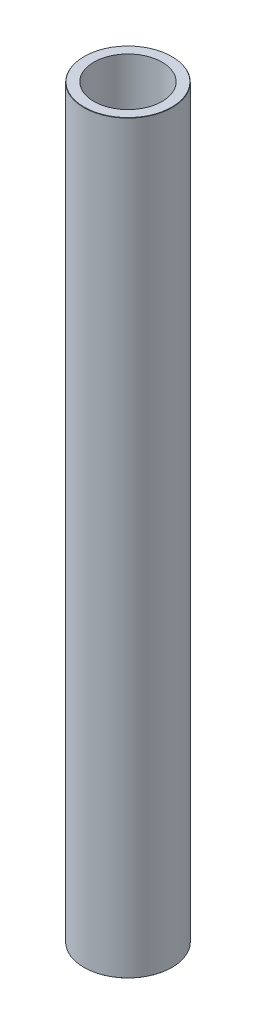
from build123d import *
from OCP.BRepFilletAPI import BRepFilletAPI_MakeChamfer

# Parameters (mm, degrees)
SKETCH1_R           = 32.5
BOSS_EXTRUDE1_DEPTH = 549.26050672
SKETCH2_R           = 25.127317011
CUT_EXTRUDE1_DEPTH  = 552.180192172
CHAMFER1_SIZE       = 0.217891045
CHAMFER1_SIZE2      = 0.183419026


with BuildPart() as part:
    # Sketch1 → Boss-Extrude1 (new body)
    with BuildSketch(Plane(origin=(0, 0, 0), x_dir=(1, 0, 0), z_dir=(0, 1, 0))):
        Circle(SKETCH1_R)
    extrude(amount=BOSS_EXTRUDE1_DEPTH)

    # Sketch2 → Cut-Extrude1 (cut, through all)
    with BuildSketch(Plane(origin=(0, 0, 0), x_dir=(1, 0, 0), z_dir=(0, 1, 0))):
        Circle(SKETCH2_R)
    extrude(amount=CUT_EXTRUDE1_DEPTH, mode=Mode.SUBTRACT)

    # Chamfer1: one chamfer whose edges measure the first distance from different faces: ONE call of the kernel's chamfer builder (chamfer() names one face for all edges)
    chamfer1_edges_1 = [part.edges().sort_by_distance(p)[0] for p in [
        (-32.5, 549.26050672, 0),
    ]]
    chamfer1_side_1 = [part.faces().sort_by_distance(p)[0] for p in [
        (-32.5, 274.63025336, 0),
    ]]
    chamfer1_edges_2 = [part.edges().sort_by_distance(p)[0] for p in [
        (-32.5, 0, 0),
    ]]
    chamfer1_side_2 = [part.faces().sort_by_distance(p)[0] for p in [
        (-31.580761184, 0, 0),
    ]]
    chamfer1 = BRepFilletAPI_MakeChamfer(part.part.solid().wrapped)
    for e in chamfer1_edges_1:
        chamfer1.Add(CHAMFER1_SIZE, CHAMFER1_SIZE2, e.wrapped, chamfer1_side_1[0].wrapped)  # the first distance lies on this face
    for e in chamfer1_edges_2:
        chamfer1.Add(CHAMFER1_SIZE, CHAMFER1_SIZE2, e.wrapped, chamfer1_side_2[0].wrapped)  # the first distance lies on this face
    add(Compound.cast(chamfer1.Shape()), mode=Mode.REPLACE)


solid = part.part
